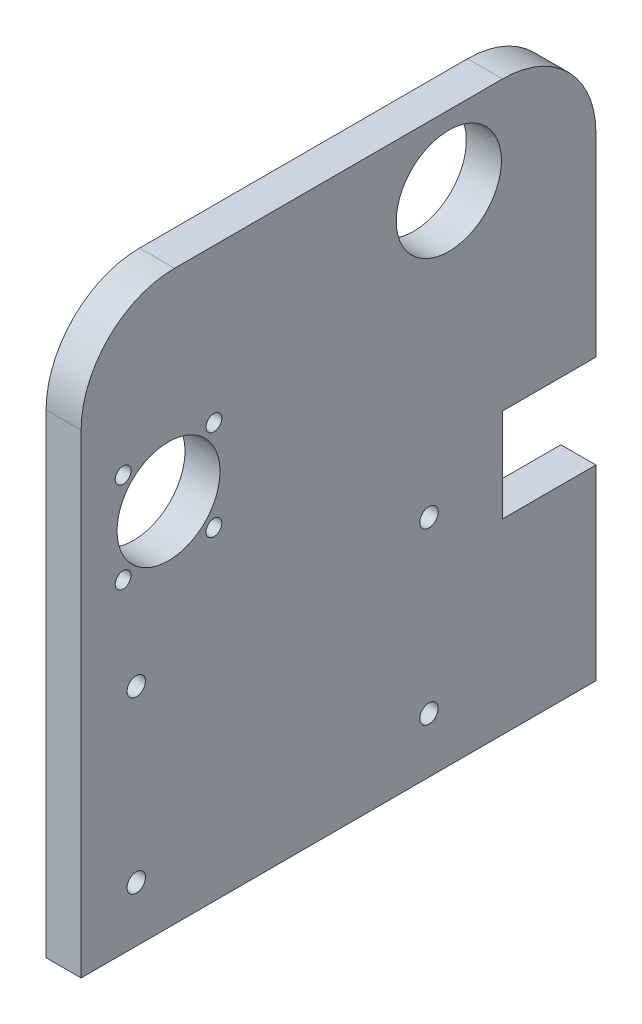
from build123d import *

# Parameters (mm, degrees)
SKETCH1_W             = 9.525
SKETCH1_H             = 140
BOSS_EXTRUDE1_DEPTH   = 77.221817616
FILLET1_R             = 25.4
SKETCH3_R             = 14.29
SKETCH3_R_2           = 2.15
SKETCH3_R_3           = 14
CUT_EXTRUDE2_DEPTH    = 28.575
SKETCH5_W             = 25.4
SKETCH5_H             = 25.4
CUT_EXTRUDE4_DEPTH    = 105.661046913
M6_TAPPED_HOLE1_D     = 5
M6_TAPPED_HOLE1_DEPTH = 10
M6_TAPPED_HOLE1_TIP   = 1.502151548
M6_TAPPED_HOLE2_D     = 5


with BuildPart() as part:
    # Sketch1 → Boss-Extrude1 (new, symmetric)
    with BuildSketch(Plane(origin=(0, 0, 0), x_dir=(1, 0, 0), z_dir=(0, 1, 0))):
        Rectangle(SKETCH1_W, SKETCH1_H)
    extrude(amount=BOSS_EXTRUDE1_DEPTH, both=True)

    # Fillet1
    fillet1_edges = [part.edges().sort_by_distance(p)[0] for p in [
        (0, 77.221817616, 70),
        (0, 77.221817616, -70),
    ]]
    fillet(fillet1_edges, radius=FILLET1_R)

    # Sketch3 → Cut-Extrude2 (cut)
    with BuildSketch(Plane.ZY.offset(4.7625)):
        with Locations((-30, 58.171817616)):
            Circle(SKETCH3_R)
        with Locations((33.881108209, 35.519669782)):
            Circle(SKETCH3_R_2)
        with Locations((58.576812542, 35.519669782)):
            Circle(SKETCH3_R_2)
        with Locations((33.881108209, 10.82396545)):
            Circle(SKETCH3_R_2)
        with Locations((58.576812542, 10.82396545)):
            Circle(SKETCH3_R_2)
        with Locations((46.228960376, 23.171817616)):
            Circle(SKETCH3_R_3)
    extrude(amount=-CUT_EXTRUDE2_DEPTH, mode=Mode.SUBTRACT)

    # Sketch5 → Cut-Extrude4 (cut, through all)
    with BuildSketch(Plane.ZY.offset(4.7625)):
        with Locations((-57.3, -13.696417616)):
            Rectangle(SKETCH5_W, SKETCH5_H)
    extrude(amount=-CUT_EXTRUDE4_DEPTH, mode=Mode.SUBTRACT)

    # M6 Tapped Hole1
    with Locations(Plane(origin=(0, 0, -44.6), x_dir=(-1, 0, 0), z_dir=(0, 0, -1))):
        with Locations((0, -13.696417616)):
            Hole(M6_TAPPED_HOLE1_D / 2, depth=M6_TAPPED_HOLE1_DEPTH)
            with Locations((0, 0, -(M6_TAPPED_HOLE1_DEPTH + M6_TAPPED_HOLE1_TIP / 2))):  # 118° drill point
                Cone(0, M6_TAPPED_HOLE1_D / 2, M6_TAPPED_HOLE1_TIP, mode=Mode.SUBTRACT)

    # M6 Tapped Hole2 (through all)
    with Locations(Plane.ZY.offset(4.7625)):
        with Locations((-24.6, -15.996417616), (55, -15.996417616), (-24.6, -62.221817616), (55, -62.221817616)):
            Hole(M6_TAPPED_HOLE2_D / 2)


solid = part.part
